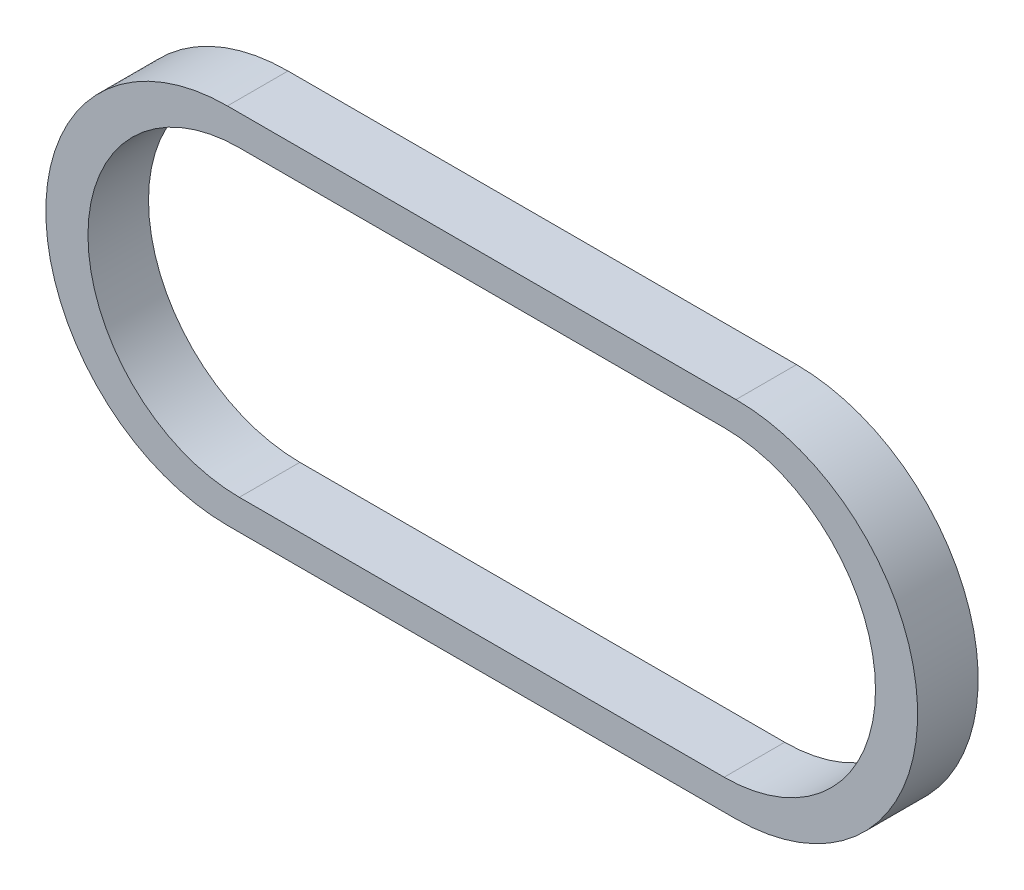
from build123d import *

# Parameters (mm, degrees)
BOSS_EXTRUDE1_DEPTH = 50
CUT_EXTRUDE1_DEPTH  = 50


with BuildPart() as part:
    # Sketch1 → Boss-Extrude1 (new body)
    with BuildSketch(Plane.XY):
        with BuildLine():
            Line((-210, 150), (210, 150))
            ThreePointArc((210, 150), (360, 0), (210, -150))
            Line((210, -150), (-210, -150))
            ThreePointArc((-210, -150), (-360, 0), (-210, 150))
        make_face()
    extrude(amount=BOSS_EXTRUDE1_DEPTH)

    # Sketch2 → Cut-Extrude1 (cut)
    with BuildSketch(Plane.XY.offset(50)):
        with BuildLine():
            Line((200.1935, -125), (-200.1935, -125))
            ThreePointArc((-200.1935, -125), (-325.1935, 0), (-200.1935, 125))
            Line((-200.1935, 125), (200.1935, 125))
            ThreePointArc((200.1935, 125), (325.1935, 0), (200.1935, -125))
        make_face()
    extrude(amount=-CUT_EXTRUDE1_DEPTH, mode=Mode.SUBTRACT)


solid = part.part
